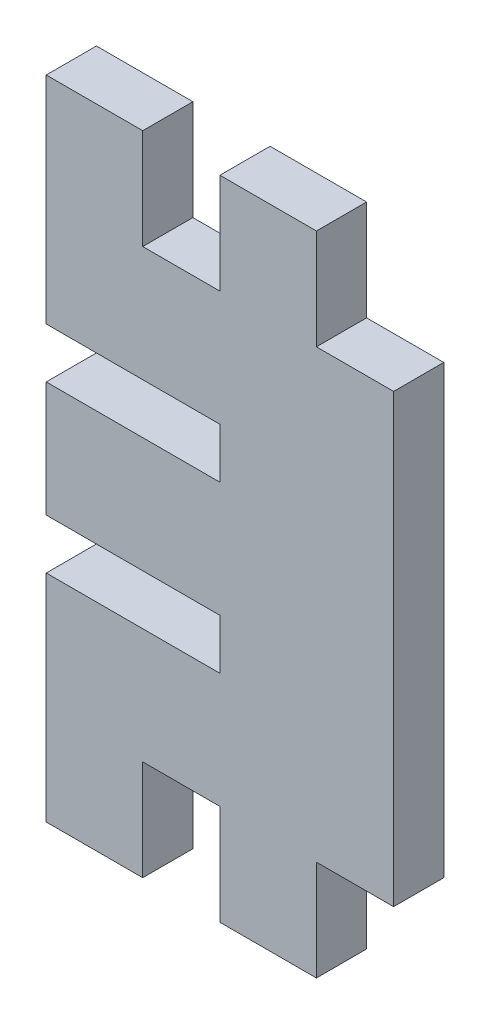
from build123d import *

# Parameters (mm, degrees)
BOSS_EXTRUDE2_DEPTH = 5.2


with BuildPart() as part:
    # Sketch1 → Boss-Extrude2 (new body)
    with BuildSketch(Plane.XY):
        Polygon((-18, 5.975), (-18, -5.975), (0, -5.975), (0, -11.175), (-18, -11.175), (-18, -33.525), (-8, -33.525), (-8, -23.125), (0, -23.125), (0, -33.525), (10, -33.525), (10, -23.125), (18, -23.125), (18, 23.125), (10, 23.125), (10, 33.525), (0, 33.525), (0, 23.125), (-8, 23.125), (-8, 33.525), (-18, 33.525), (-18, 11.175), (0, 11.175), (0, 5.975), align=None)
    extrude(amount=BOSS_EXTRUDE2_DEPTH)


solid = part.part
